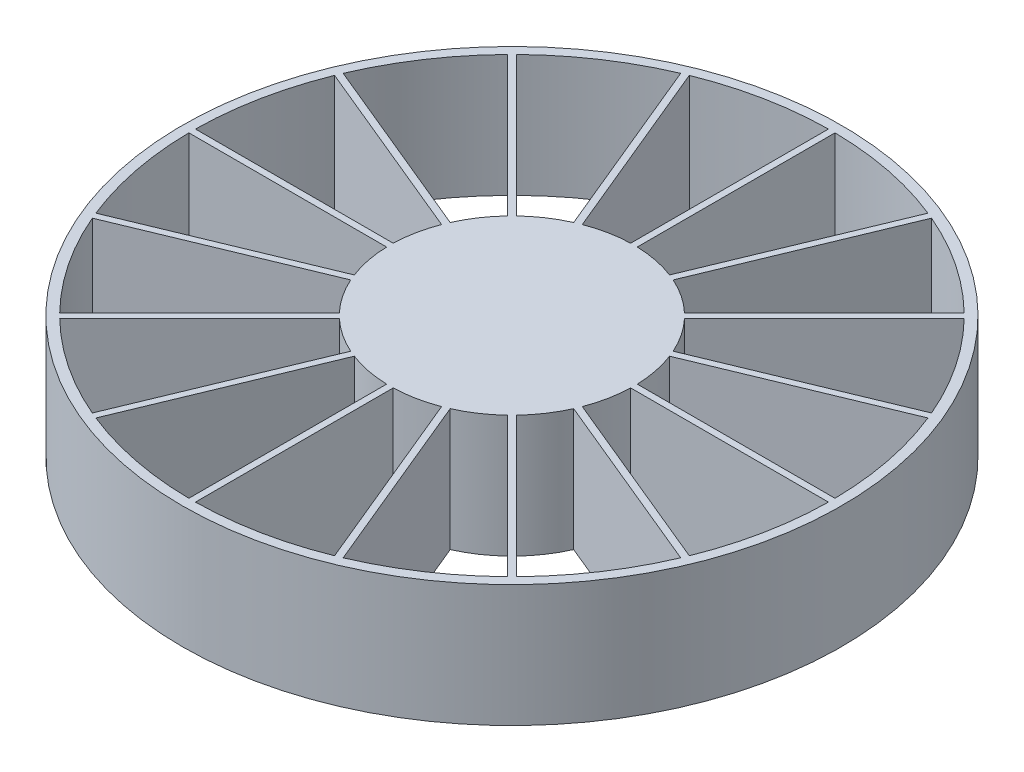
from build123d import *

# Parameters (mm, degrees)
BOSS_EXTRUDE1_OUTLINE_R = 67.5
BOSS_EXTRUDE1_DEPTH     = 25
SKETCH2_R               = 2.5
CUT_EXTRUDE2_DEPTH      = 18
SKETCH4_R               = 25
BOSS_EXTRUDE3_DEPTH     = 35
CUT_EXTRUDE4_DEPTH      = 18
CUT_EXTRUDE7_DEPTH      = 2
CUT_EXTRUDE8_DEPTH      = 20
SKETCH9_R               = 3.5
CUT_EXTRUDE9_DEPTH      = 1
CUT_EXTRUDE10_START     = -10
SKETCH10_R              = 25
CUT_EXTRUDE10_DEPTH     = 10


# Read off the part's stored shape, not the designer's step: Boss-Extrude1
with BuildPart() as part:
    # Boss-Extrude1 outline → Boss-Extrude1 (new body)
    with BuildSketch(Plane(origin=(0, 0, 0), x_dir=(1, 0, 0), z_dir=(0, 1, 0))):
        Circle(BOSS_EXTRUDE1_OUTLINE_R)
        with BuildLine():
            ThreePointArc((-13.30331837, -14.257339175), (-10.833619544, -16.21365744), (-8.081104316, -17.746711048))
            Line((-8.081104316, -17.746711048), (-25.687679516, -60.252743681))
            ThreePointArc((-25.687679516, -60.252743681), (-36.389850263, -54.461259606), (-45.836027298, -46.790048103))
            Line((-45.836027298, -46.790048103), (-13.30331837, -14.257339175))
        make_face(mode=Mode.SUBTRACT)
        with BuildLine():
            ThreePointArc((-6.834616064, -18.263023388), (-3.804261279, -19.125312968), (-0.674594581, -19.488327844))
            Line((-0.674594581, -19.488327844), (-0.674594581, -65.496526031))
            ThreePointArc((-0.674594581, -65.496526031), (-12.778416092, -64.241435866), (-24.441191264, -60.76905602))
            Line((-24.441191264, -60.76905602), (-6.834616064, -18.263023388))
        make_face(mode=Mode.SUBTRACT)
        with BuildLine():
            ThreePointArc((-17.746711048, -8.081104316), (-16.21365744, -10.833619544), (-14.257339175, -13.30331837))
            Line((-14.257339175, -13.30331837), (-46.790048103, -45.836027298))
            ThreePointArc((-46.790048103, -45.836027298), (-54.461259606, -36.389850263), (-60.252743681, -25.687679516))
            Line((-60.252743681, -25.687679516), (-17.746711048, -8.081104316))
        make_face(mode=Mode.SUBTRACT)
        with BuildLine():
            ThreePointArc((-19.488327844, -0.674594581), (-19.125312968, -3.804261279), (-18.263023388, -6.834616064))
            Line((-18.263023388, -6.834616064), (-60.76905602, -24.441191264))
            ThreePointArc((-60.76905602, -24.441191264), (-64.241435866, -12.778416092), (-65.496526031, -0.674594581))
            Line((-65.496526031, -0.674594581), (-19.488327844, -0.674594581))
        make_face(mode=Mode.SUBTRACT)
        with BuildLine():
            ThreePointArc((0.674594581, -19.488327844), (3.804261279, -19.125312968), (6.834616064, -18.263023388))
            Line((6.834616064, -18.263023388), (24.441191264, -60.76905602))
            ThreePointArc((24.441191264, -60.76905602), (12.778416092, -64.241435866), (0.674594581, -65.496526031))
            Line((0.674594581, -65.496526031), (0.674594581, -19.488327844))
        make_face(mode=Mode.SUBTRACT)
        with BuildLine():
            ThreePointArc((8.081104316, -17.746711048), (10.833619544, -16.21365744), (13.30331837, -14.257339175))
            Line((13.30331837, -14.257339175), (45.836027298, -46.790048103))
            ThreePointArc((45.836027298, -46.790048103), (36.389850263, -54.461259606), (25.687679516, -60.252743681))
            Line((25.687679516, -60.252743681), (8.081104316, -17.746711048))
        make_face(mode=Mode.SUBTRACT)
        with BuildLine():
            ThreePointArc((14.257339175, -13.30331837), (16.21365744, -10.833619544), (17.746711048, -8.081104316))
            Line((17.746711048, -8.081104316), (60.252743681, -25.687679516))
            ThreePointArc((60.252743681, -25.687679516), (54.461259606, -36.389850263), (46.790048103, -45.836027298))
            Line((46.790048103, -45.836027298), (14.257339175, -13.30331837))
        make_face(mode=Mode.SUBTRACT)
        with BuildLine():
            ThreePointArc((18.263023388, -6.834616064), (19.125312968, -3.804261279), (19.488327844, -0.674594581))
            Line((19.488327844, -0.674594581), (65.496526031, -0.674594581))
            ThreePointArc((65.496526031, -0.674594581), (64.241435866, -12.778416092), (60.76905602, -24.441191264))
            Line((60.76905602, -24.441191264), (18.263023388, -6.834616064))
        make_face(mode=Mode.SUBTRACT)
        with BuildLine():
            ThreePointArc((-18.263023388, 6.834616064), (-19.125312968, 3.804261279), (-19.488327844, 0.674594581))
            Line((-19.488327844, 0.674594581), (-65.496526031, 0.674594581))
            ThreePointArc((-65.496526031, 0.674594581), (-64.241435866, 12.778416092), (-60.76905602, 24.441191264))
            Line((-60.76905602, 24.441191264), (-18.263023388, 6.834616064))
        make_face(mode=Mode.SUBTRACT)
        with BuildLine():
            ThreePointArc((-14.257339175, 13.30331837), (-16.21365744, 10.833619544), (-17.746711048, 8.081104316))
            Line((-17.746711048, 8.081104316), (-60.252743681, 25.687679516))
            ThreePointArc((-60.252743681, 25.687679516), (-54.461259606, 36.389850263), (-46.790048103, 45.836027298))
            Line((-46.790048103, 45.836027298), (-14.257339175, 13.30331837))
        make_face(mode=Mode.SUBTRACT)
        with BuildLine():
            ThreePointArc((-8.081104316, 17.746711048), (-10.833619544, 16.21365744), (-13.30331837, 14.257339175))
            Line((-13.30331837, 14.257339175), (-45.836027298, 46.790048103))
            ThreePointArc((-45.836027298, 46.790048103), (-36.389850263, 54.461259606), (-25.687679516, 60.252743681))
            Line((-25.687679516, 60.252743681), (-8.081104316, 17.746711048))
        make_face(mode=Mode.SUBTRACT)
        with BuildLine():
            Line((-6.834616064, 18.263023388), (-24.441191264, 60.76905602))
            ThreePointArc((-24.441191264, 60.76905602), (-12.778416092, 64.241435866), (-0.674594581, 65.496526031))
            Line((-0.674594581, 65.496526031), (-0.674594581, 19.488327844))
            ThreePointArc((-0.674594581, 19.488327844), (-3.804261279, 19.125312968), (-6.834616064, 18.263023388))
        make_face(mode=Mode.SUBTRACT)
        with BuildLine():
            ThreePointArc((19.488327844, 0.674594581), (19.125312968, 3.804261279), (18.263023388, 6.834616064))
            Line((18.263023388, 6.834616064), (60.76905602, 24.441191264))
            ThreePointArc((60.76905602, 24.441191264), (64.241435866, 12.778416092), (65.496526031, 0.674594581))
            Line((65.496526031, 0.674594581), (19.488327844, 0.674594581))
        make_face(mode=Mode.SUBTRACT)
        with BuildLine():
            ThreePointArc((17.746711048, 8.081104316), (16.21365744, 10.833619544), (14.257339175, 13.30331837))
            Line((14.257339175, 13.30331837), (46.790048103, 45.836027298))
            ThreePointArc((46.790048103, 45.836027298), (54.461259606, 36.389850263), (60.252743681, 25.687679516))
            Line((60.252743681, 25.687679516), (17.746711048, 8.081104316))
        make_face(mode=Mode.SUBTRACT)
        with BuildLine():
            ThreePointArc((6.834616064, 18.263023388), (3.804261279, 19.125312968), (0.674594581, 19.488327844))
            Line((0.674594581, 19.488327844), (0.674594581, 65.496526031))
            ThreePointArc((0.674594581, 65.496526031), (12.778416092, 64.241435866), (24.441191264, 60.76905602))
            Line((24.441191264, 60.76905602), (6.834616064, 18.263023388))
        make_face(mode=Mode.SUBTRACT)
        with BuildLine():
            ThreePointArc((13.30331837, 14.257339175), (10.833619544, 16.21365744), (8.081104316, 17.746711048))
            Line((8.081104316, 17.746711048), (25.687679516, 60.252743681))
            ThreePointArc((25.687679516, 60.252743681), (36.389850263, 54.461259606), (45.836027298, 46.790048103))
            Line((45.836027298, 46.790048103), (13.30331837, 14.257339175))
        make_face(mode=Mode.SUBTRACT)
    extrude(amount=BOSS_EXTRUDE1_DEPTH)

    # Sketch2 → Cut-Extrude2 (cut)
    with BuildSketch(Plane.XZ):
        with Locations(Location((0, 0, 0), (0, 0, 270))):
            Circle(SKETCH2_R)
    extrude(amount=-CUT_EXTRUDE2_DEPTH, mode=Mode.SUBTRACT)

    # Sketch4 → Boss-Extrude3 (add)
    with BuildSketch(Plane(origin=(0, 0, 0), x_dir=(1, 0, 0), z_dir=(0, 1, 0))):
        with Locations(Location((0, 0, 0), (0, 0, 91.546244576))):
            Circle(SKETCH4_R)
    extrude(amount=BOSS_EXTRUDE3_DEPTH)

    # Sketch5 → Cut-Extrude4 (cut)
    with BuildSketch(Plane.XZ):
        with BuildLine():
            Line((-1.5, 2), (1.5, 2))
            ThreePointArc((1.5, 2), (0, -2.5), (-1.5, 2))
        make_face()
    extrude(amount=-CUT_EXTRUDE4_DEPTH, mode=Mode.SUBTRACT)

    # Sketch6 → Cut-Extrude7 (cut)
    with BuildSketch(Plane.XZ):
        with BuildLine():
            Line((-7.714466094, 14.785533906), (0, 7.071067812))
            Line((0, 7.071067812), (7.714466094, 14.785533906))
            Line((7.714466094, 14.785533906), (11.976558152, 19.047625963))
            ThreePointArc((11.976558152, 19.047625963), (15.909902577, 15.909902577), (19.047625963, 11.976558152))
            Line((19.047625963, 11.976558152), (14.785533906, 7.714466094))
            Line((14.785533906, 7.714466094), (7.071067812, 0))
            Line((7.071067812, 0), (14.785533906, -7.714466094))
            Line((14.785533906, -7.714466094), (19.047625963, -11.976558152))
            ThreePointArc((19.047625963, -11.976558152), (15.909902577, -15.909902577), (11.976558152, -19.047625963))
            Line((11.976558152, -19.047625963), (7.714466094, -14.785533906))
            Line((7.714466094, -14.785533906), (0, -7.071067812))
            Line((0, -7.071067812), (-7.714466094, -14.785533906))
            Line((-7.714466094, -14.785533906), (-11.976558152, -19.047625963))
            ThreePointArc((-11.976558152, -19.047625963), (-15.909902577, -15.909902577), (-19.047625963, -11.976558152))
            Line((-19.047625963, -11.976558152), (-14.785533906, -7.714466094))
            Line((-14.785533906, -7.714466094), (-7.071067812, 0))
            Line((-7.071067812, 0), (-14.785533906, 7.714466094))
            Line((-14.785533906, 7.714466094), (-19.047625963, 11.976558152))
            ThreePointArc((-19.047625963, 11.976558152), (-15.909902577, 15.909902577), (-11.976558152, 19.047625963))
            Line((-11.976558152, 19.047625963), (-7.714466094, 14.785533906))
        make_face()
    extrude(amount=-CUT_EXTRUDE7_DEPTH, mode=Mode.SUBTRACT)

    # Sketch7 → Cut-Extrude8 (cut)
    with BuildSketch(Plane.XZ):
        with BuildLine():
            Line((9.899494937, 0), (20.070097993, 10.170603057))
            ThreePointArc((20.070097993, 10.170603057), (22.5, 0), (20.070097993, -10.170603057))
            Line((20.070097993, -10.170603057), (9.899494937, 0))
        make_face()
        with BuildLine():
            Line((0, 9.899494937), (-10.170603057, 20.070097993))
            ThreePointArc((-10.170603057, 20.070097993), (0, 22.5), (10.170603057, 20.070097993))
            Line((10.170603057, 20.070097993), (0, 9.899494937))
        make_face()
        with BuildLine():
            Line((0, -9.899494937), (10.170603057, -20.070097993))
            ThreePointArc((10.170603057, -20.070097993), (0, -22.5), (-10.170603057, -20.070097993))
            Line((-10.170603057, -20.070097993), (0, -9.899494937))
        make_face()
        with BuildLine():
            Line((-9.899494937, 0), (-20.070097993, -10.170603057))
            ThreePointArc((-20.070097993, -10.170603057), (-22.5, 0), (-20.070097993, 10.170603057))
            Line((-20.070097993, 10.170603057), (-9.899494937, 0))
        make_face()
    extrude(amount=-CUT_EXTRUDE8_DEPTH, mode=Mode.SUBTRACT)

    # Sketch9 → Cut-Extrude9 (cut)
    with BuildSketch(Plane(origin=(0, 2, 0), x_dir=(-1, 0, 0), z_dir=(0, -1, 0))):
        with Locations(Location((0, 0, 0), (0, 0, 90))):
            Circle(SKETCH9_R)
    extrude(amount=-CUT_EXTRUDE9_DEPTH, mode=Mode.SUBTRACT)

    # Sketch10 → Cut-Extrude10 (cut)
    with BuildSketch(Plane(origin=(0, 35, 0), x_dir=(1, 0, 0), z_dir=(0, 1, 0)).offset(CUT_EXTRUDE10_START)):
        Circle(SKETCH10_R)
    extrude(amount=CUT_EXTRUDE10_DEPTH, mode=Mode.SUBTRACT)


solid = part.part
